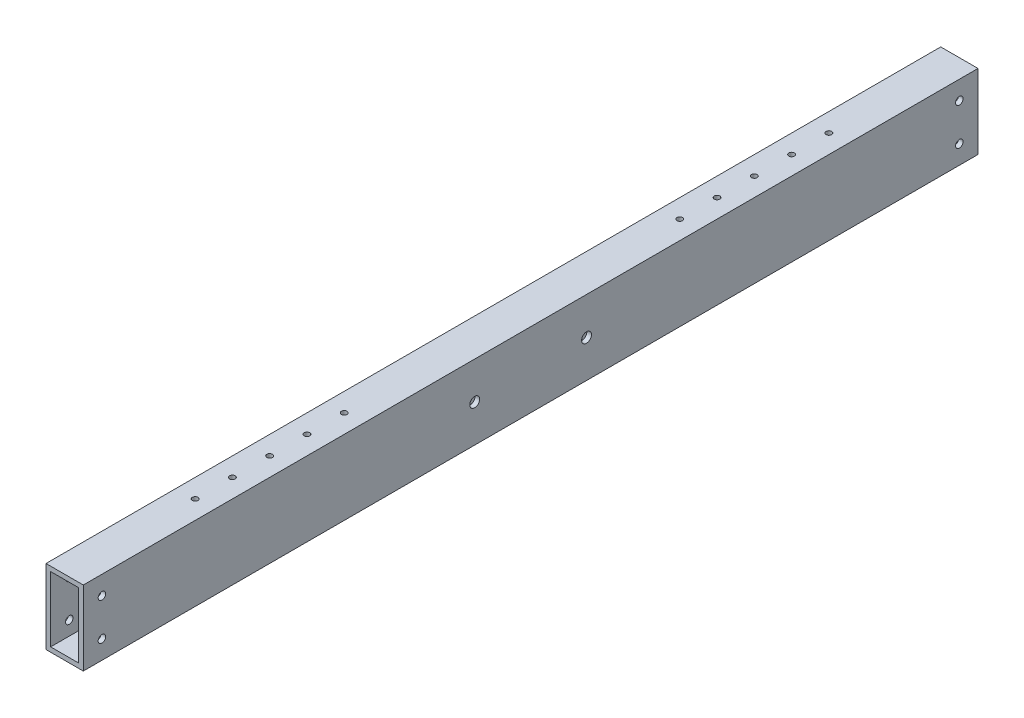
from build123d import *

# Parameters (mm, degrees)
SKETCH1_W               = 25.4
SKETCH1_H               = 50.8
SKETCH1_W_2             = 19.05
SKETCH1_H_2             = 44.45
BOSS_EXTRUDE1_DEPTH     = 304.8
F_10_CLEARANCE_HOLE1_D  = 5.1054
F_1_4_CLEARANCE_HOLE2_D = 6.7564
SKETCH7_R               = 1.905
CUT_EXTRUDE1_DEPTH      = 310.265209812


with BuildPart() as part:
    # Sketch1 → Boss-Extrude1 (new, symmetric)
    with BuildSketch(Plane.XY):
        Rectangle(SKETCH1_W, SKETCH1_H)
        Rectangle(SKETCH1_W_2, SKETCH1_H_2, mode=Mode.SUBTRACT)
    extrude(amount=BOSS_EXTRUDE1_DEPTH, both=True)

    # #10 Clearance Hole1 (through all)
    with Locations(Plane(origin=(12.7, 0, 0), x_dir=(0, 0, -1), z_dir=(1, 0, 0))):
        with Locations((-292.1, 12.7), (-292.1, -12.7)):
            f_10_clearance_hole1 = Hole(F_10_CLEARANCE_HOLE1_D / 2)

    # Mirror1: #10 Clearance Hole1 across plane
    add(f_10_clearance_hole1.mirror(Plane.XY), mode=Mode.SUBTRACT)

    # 1/4 Clearance Hole2 (through all)
    with Locations(Plane(origin=(12.7, 0, 0), x_dir=(0, 0, -1), z_dir=(1, 0, 0))):
        with Locations((-38.1, 0), (38.1, 0)):
            Hole(F_1_4_CLEARANCE_HOLE2_D / 2)

    # Sketch7 → Cut-Extrude1 (cut, through all)
    with BuildSketch(Plane(origin=(0, 25.4, 0), x_dir=(1, 0, 0), z_dir=(0, 1, 0))):
        with Locations((0, 215.9)):
            Circle(SKETCH7_R)
        with Locations((0, 190.5)):
            Circle(SKETCH7_R)
        with Locations((0, 165.1)):
            Circle(SKETCH7_R)
        with Locations((0, 139.7)):
            Circle(SKETCH7_R)
        with Locations((0, 114.3)):
            Circle(SKETCH7_R)
    cut_extrude1 = extrude(amount=-CUT_EXTRUDE1_DEPTH, mode=Mode.SUBTRACT)

    # Mirror2: Cut-Extrude1 across plane
    add(cut_extrude1.mirror(Plane.XY), mode=Mode.SUBTRACT)


solid = part.part
